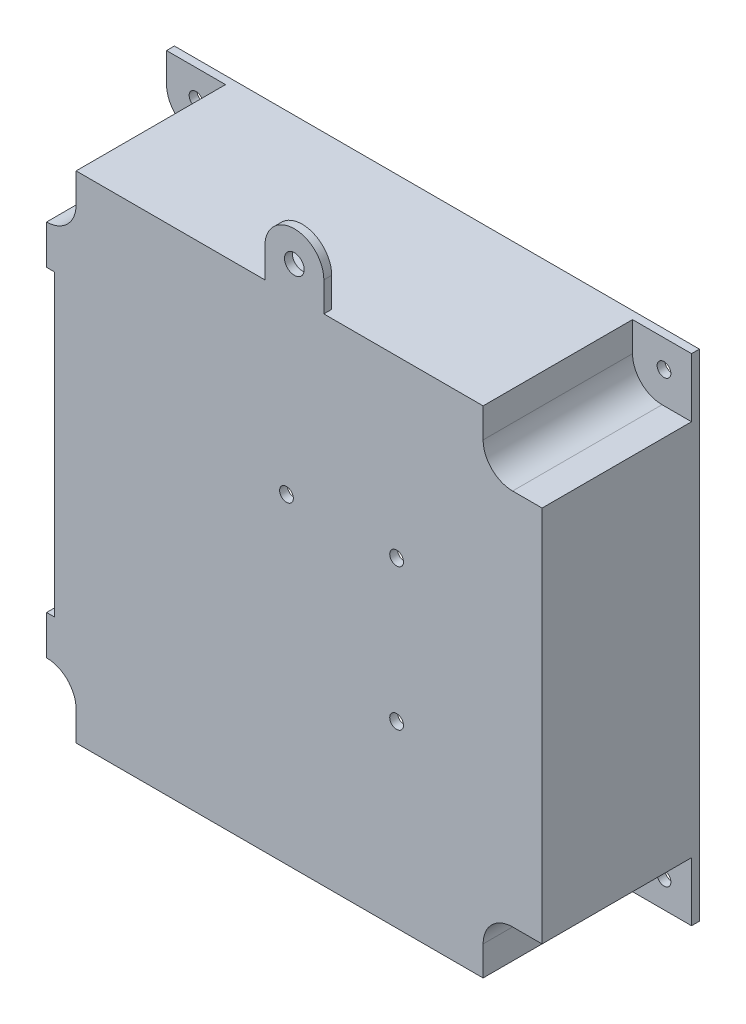
from build123d import *

# Parameters (mm, degrees)
ESQUISSE1_W                = 126
ESQUISSE1_H                = 126
BOSS_EXTRU_1_DEPTH         = 40
ENL_V_MAT_EXTRU_1_DEPTH    = 38
ENL_V_MAT_EXTRU_2_REACH    = 223.428
ESQUISSE4_R                = 1.75
ENL_V_MAT_EXTRU_5_DEPTH    = 38
COQUE1_DEPTH               = 38
BOSS_EXTRU_3_DEPTH         = 2
ENL_V_MAT_EXTRU_6_REACH    = 228.624
ESQUISSE13_R               = 1.75
ENL_V_MAT_EXTRU_7_REACH    = 228.968
ESQUISSE14_R               = 1.75
R_P_TITION_LIN_AIRE1_COUNT = 2
R_P_TITION_LIN_AIRE1_PITCH = 28
ENL_V_MAT_EXTRU_8_REACH    = 228.968
ESQUISSE15_R               = 1.75
ESQUISSE16_W               = 40
ESQUISSE16_H               = 76
ENL_V_MAT_EXTRU_9_DEPTH    = 2
BOSS_EXTRU_4_DEPTH         = 2
ENL_V_MAT_EXTRU_10_REACH   = 239.591
ESQUISSE19_R               = 2.5


# Read off the part's stored shape, not the designer's step: Coque1
with BuildPart() as part:
    # Esquisse1 → Boss.-Extru.1 (new body)
    with BuildSketch(Plane.XY):
        with Locations((-88.440384558, 94.010362694)):
            Rectangle(ESQUISSE1_W, ESQUISSE1_H)
    extrude(amount=BOSS_EXTRU_1_DEPTH)

    # Esquisse2 → Enlèv. mat.-Extru.1 (cut)
    with BuildSketch(Plane.XY.offset(40)):
        with BuildLine():
            Line((-40.440384558, 31.010362694), (-25.440384558, 31.010362694))
            Line((-25.440384558, 31.010362694), (-25.440384558, 46.010362694))
            Line((-25.440384558, 46.010362694), (-32.940384558, 46.010362694))
            ThreePointArc((-32.940384558, 46.010362694), (-38.243685417, 43.813663553), (-40.440384558, 38.510362694))
            Line((-40.440384558, 38.510362694), (-40.440384558, 31.010362694))
        make_face()
    enl_v_mat_extru_1 = extrude(amount=-ENL_V_MAT_EXTRU_1_DEPTH, mode=Mode.SUBTRACT)

    # Esquisse4 → Enlèv. mat.-Extru.2 (cut, up to next)
    with BuildSketch(Plane.XY.offset(2), mode=Mode.PRIVATE) as enl_v_mat_extru_2_sk1:
        with Locations((-32.440384558, 38.010362694)):
            Circle(ESQUISSE4_R)
    enl_v_mat_extru_2_tool1 = extrude(enl_v_mat_extru_2_sk1.sketch, amount=-ENL_V_MAT_EXTRU_2_REACH, mode=Mode.PRIVATE) & part.part
    enl_v_mat_extru_2 = enl_v_mat_extru_2_tool1.solids().sort_by_distance((-32.440385, 38.010363, 2))[0]
    add(enl_v_mat_extru_2, mode=Mode.SUBTRACT)

    # Symétrie1: Enlèv. mat.-Extru.1, Enlèv. mat.-Extru.2 across plane
    add(enl_v_mat_extru_1.mirror(Plane(origin=(0, 94.010362694, 0), x_dir=(0, 0, 1), z_dir=(0, -1, 0))), mode=Mode.SUBTRACT)
    add(enl_v_mat_extru_2.mirror(Plane(origin=(0, 94.010362694, 0), x_dir=(0, 0, 1), z_dir=(0, -1, 0))), mode=Mode.SUBTRACT)

    # Esquisse10 → Enlèv. mat.-Extru.5 (cut)
    with BuildSketch(Plane.XY.offset(40)):
        with BuildLine():
            Line((-151.440384558, 46.010362694), (-151.440384558, 31.010362694))
            Line((-151.440384558, 31.010362694), (-143.940384558, 31.010362694))
            Line((-143.940384558, 31.010362694), (-143.940384558, 38.510362694))
            ThreePointArc((-143.940384558, 38.510362694), (-146.137083699, 43.813663553), (-151.440384558, 46.010362694))
        make_face()
    enl_v_mat_extru_5 = extrude(amount=-ENL_V_MAT_EXTRU_5_DEPTH, mode=Mode.SUBTRACT)

    # Symétrie3: Enlèv. mat.-Extru.5 across plane
    add(enl_v_mat_extru_5.mirror(Plane(origin=(0, 94.010362694, 0), x_dir=(0, 0, 1), z_dir=(0, -1, 0))), mode=Mode.SUBTRACT)

    # Coque1 outline → Coque1 (cut)
    with BuildSketch(Plane.XY):
        with BuildLine():
            Line((-42.440384558, 155.010362694), (-141.940384558, 155.010362694))
            Line((-141.940384558, 155.010362694), (-141.940384558, 149.510362694))
            ThreePointArc((-141.940384558, 149.510362694), (-144.049511808, 143.541694501), (-149.440384558, 140.223274884))
            Line((-149.440384558, 140.223274884), (-149.440384558, 47.797450505))
            ThreePointArc((-149.440384558, 47.797450505), (-144.049511808, 44.479030887), (-141.940384558, 38.510362694))
            Line((-141.940384558, 38.510362694), (-141.940384558, 33.010362694))
            Line((-141.940384558, 33.010362694), (-42.440384558, 33.010362694))
            Line((-42.440384558, 33.010362694), (-42.440384558, 38.510362694))
            ThreePointArc((-42.440384558, 38.510362694), (-39.657898979, 45.227877116), (-32.940384558, 48.010362694))
            Line((-32.940384558, 48.010362694), (-27.440384558, 48.010362694))
            Line((-27.440384558, 48.010362694), (-27.440384558, 140.010362694))
            Line((-27.440384558, 140.010362694), (-32.940384558, 140.010362694))
            ThreePointArc((-32.940384558, 140.010362694), (-39.657898979, 142.792848273), (-42.440384558, 149.510362694))
            Line((-42.440384558, 149.510362694), (-42.440384558, 155.010362694))
        make_face()
    extrude(amount=COQUE1_DEPTH, mode=Mode.SUBTRACT)

    # Esquisse12 → Boss.-Extru.3 (add)
    with BuildSketch(Plane.XY.offset(2)):
        with BuildLine():
            Line((-158.940384558, 31.010362694), (-158.940384558, 38.510362694))
            ThreePointArc((-158.940384558, 38.510362694), (-156.743685417, 43.813663553), (-151.440384558, 46.010362694))
            Line((-151.440384558, 46.010362694), (-151.440384558, 31.010362694))
            Line((-151.440384558, 31.010362694), (-158.940384558, 31.010362694))
        make_face()
    boss_extru_3 = extrude(amount=-BOSS_EXTRU_3_DEPTH)

    # Esquisse13 → Enlèv. mat.-Extru.6 (cut, up to next)
    with BuildSketch(Plane.XY.offset(2), mode=Mode.PRIVATE) as enl_v_mat_extru_6_sk1:
        with Locations((-151.440384558, 38.010362694)):
            Circle(ESQUISSE13_R)
    enl_v_mat_extru_6_tool1 = extrude(enl_v_mat_extru_6_sk1.sketch, amount=-ENL_V_MAT_EXTRU_6_REACH, mode=Mode.PRIVATE) & part.part
    enl_v_mat_extru_6 = enl_v_mat_extru_6_tool1.solids().sort_by_distance((-151.440385, 38.010363, 2))[0]
    add(enl_v_mat_extru_6, mode=Mode.SUBTRACT)

    # Symétrie5: Boss.-Extru.3, Enlèv. mat.-Extru.6 across plane
    add(boss_extru_3.mirror(Plane(origin=(0, 94.010362694, 0), x_dir=(0, 0, 1), z_dir=(0, -1, 0))))
    add(enl_v_mat_extru_6.mirror(Plane(origin=(0, 94.010362694, 0), x_dir=(0, 0, 1), z_dir=(0, -1, 0))), mode=Mode.SUBTRACT)

    # Esquisse14 → Enlèv. mat.-Extru.7 (cut, up to next)
    with BuildSketch(Plane.XY.offset(40), mode=Mode.PRIVATE) as enl_v_mat_extru_7_sk1:
        with Locations((-90.440384558, 112.510362694)):
            Circle(ESQUISSE14_R)
    enl_v_mat_extru_7_tool1 = extrude(enl_v_mat_extru_7_sk1.sketch, amount=-ENL_V_MAT_EXTRU_7_REACH, mode=Mode.PRIVATE) & part.part
    enl_v_mat_extru_7 = enl_v_mat_extru_7_tool1.solids().sort_by_distance((-90.440385, 112.510363, 40))[0]
    add(enl_v_mat_extru_7, mode=Mode.SUBTRACT)

    # Répétition linéaire1: Enlèv. mat.-Extru.7 ×2
    with Locations(*[(i * R_P_TITION_LIN_AIRE1_PITCH, 0, 0) for i in range(1, R_P_TITION_LIN_AIRE1_COUNT)]):
        add(enl_v_mat_extru_7, mode=Mode.SUBTRACT)

    # Esquisse15 → Enlèv. mat.-Extru.8 (cut, up to next)
    with BuildSketch(Plane.XY.offset(40), mode=Mode.PRIVATE) as enl_v_mat_extru_8_sk1:
        with Locations((-62.440384558, 76.510362694)):
            Circle(ESQUISSE15_R)
    enl_v_mat_extru_8_tool1 = extrude(enl_v_mat_extru_8_sk1.sketch, amount=-ENL_V_MAT_EXTRU_8_REACH, mode=Mode.PRIVATE) & part.part
    add(enl_v_mat_extru_8_tool1.solids().sort_by_distance((-62.440385, 76.510363, 40))[0], mode=Mode.SUBTRACT)

    # Esquisse16 → Enlèv. mat.-Extru.9 (cut)
    with BuildSketch(Plane.ZY.offset(151.440384558)):
        with Locations((20, 94.010362694)):
            Rectangle(ESQUISSE16_W, ESQUISSE16_H)
    extrude(amount=-ENL_V_MAT_EXTRU_9_DEPTH, mode=Mode.SUBTRACT)

    # Esquisse17 → Boss.-Extru.4 (add)
    with BuildSketch(Plane.XY.offset(40)):
        with BuildLine():
            Line((-95.940384558, 157.010362694), (-80.940384558, 157.010362694))
            Line((-80.940384558, 157.010362694), (-80.940384558, 164.510362694))
            ThreePointArc((-80.940384558, 164.510362694), (-88.440384558, 172.010362694), (-95.940384558, 164.510362694))
            Line((-95.940384558, 164.510362694), (-95.940384558, 157.010362694))
        make_face()
    extrude(amount=-BOSS_EXTRU_4_DEPTH)

    # Esquisse19 → Enlèv. mat.-Extru.10 (cut, up to next)
    with BuildSketch(Plane.XY.offset(40), mode=Mode.PRIVATE) as enl_v_mat_extru_10_sk1:
        with Locations((-88.440384558, 164.260362694)):
            Circle(ESQUISSE19_R)
    enl_v_mat_extru_10_tool1 = extrude(enl_v_mat_extru_10_sk1.sketch, amount=-ENL_V_MAT_EXTRU_10_REACH, mode=Mode.PRIVATE) & part.part
    add(enl_v_mat_extru_10_tool1.solids().sort_by_distance((-88.440385, 164.260363, 40))[0], mode=Mode.SUBTRACT)


solid = part.part
